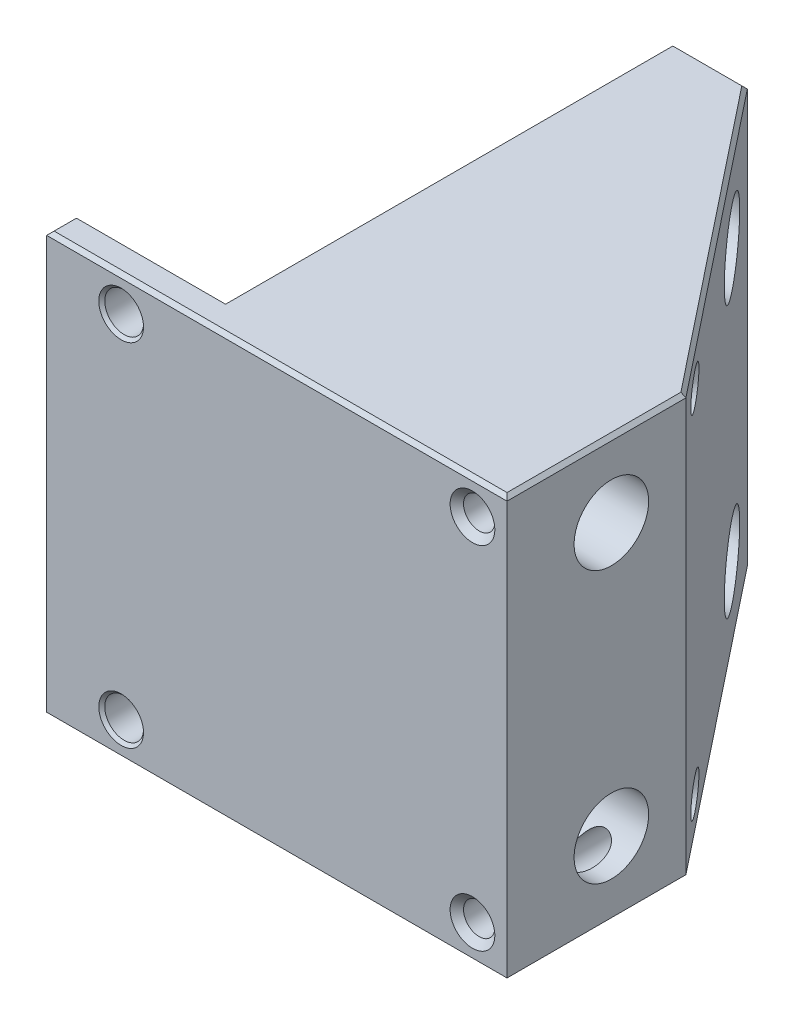
from build123d import *

# Parameters (mm, degrees)
SKETCH1_W                       = 61.76
SKETCH1_H                       = 56.4
BOSS_EXTRUDE1_DEPTH             = 4
M5X0_8_TAPPED_HOLE1_D           = 4.2
M5X0_8_TAPPED_HOLE1_CSINK_D     = 6
M5X0_8_TAPPED_HOLE1_CSINK_ANGLE = 90
BOSS_EXTRUDE7_START             = 60
SKETCH37_W                      = 41.76
SKETCH37_H                      = 56.4
SKETCH37_R                      = 2.1
BOSS_EXTRUDE7_DEPTH             = 60
SKETCH39_R                      = 2.6
CUT_EXTRUDE1_DEPTH              = 77.451385861
CUT_EXTRUDE2_DEPTH              = 88.946201737
CBORE_FOR_M5_SHCS3_D            = 5.5
CBORE_FOR_M5_SHCS3_CBORE_D      = 10
CBORE_FOR_M5_SHCS3_CBORE_DEPTH  = 36.7
CHAMFER7_SIZE                   = 0.5


with BuildPart() as part:
    # Sketch1 → Boss-Extrude1 (new body)
    with BuildSketch(Plane.XY):
        Rectangle(SKETCH1_W, SKETCH1_H)
    extrude(amount=BOSS_EXTRUDE1_DEPTH)

    # M5x0.8 Tapped Hole1 (through all)
    with Locations(Plane.XY.offset(4)):
        with Locations((26.245, 23.565), (26.245, -23.565), (-20.885, -23.565), (-20.885, 23.565)):
            CounterSinkHole(M5X0_8_TAPPED_HOLE1_D / 2, M5X0_8_TAPPED_HOLE1_CSINK_D / 2, counter_sink_angle=M5X0_8_TAPPED_HOLE1_CSINK_ANGLE)

    # Sketch37 → Boss-Extrude7 (add)
    with BuildSketch(Plane(origin=(0, 0, 0), x_dir=(-1, 0, 0), z_dir=(0, 0, -1)).offset(BOSS_EXTRUDE7_START)):
        with Locations((-10, 0)):
            Rectangle(SKETCH37_W, SKETCH37_H)
        with Locations((-26.245, 23.565)):
            Circle(SKETCH37_R, mode=Mode.SUBTRACT)
        with Locations((-26.245, -23.565)):
            Circle(SKETCH37_R, mode=Mode.SUBTRACT)
    extrude(amount=-BOSS_EXTRUDE7_DEPTH)

    # Sketch39 → Cut-Extrude1 (cut, through all)
    with BuildSketch(Plane.XY.offset(4)):
        with Locations((-20.885, -23.565)):
            Circle(SKETCH39_R)
        with Locations((-20.885, 23.565)):
            Circle(SKETCH39_R)
    extrude(amount=-CUT_EXTRUDE1_DEPTH, mode=Mode.SUBTRACT)

    # Sketch40 → Cut-Extrude2 (cut, through all)
    with BuildSketch(Plane.XZ.offset(28.2)):
        Polygon((-0.88, -60), (30.88, -20), (30.88, -60), align=None)
    extrude(amount=-CUT_EXTRUDE2_DEPTH, mode=Mode.SUBTRACT)

    # CBORE for M5 SHCS3 (through all)
    with Locations(Plane(origin=(30.88, 0, 0), x_dir=(0, 0, -1), z_dir=(1, 0, 0))):
        with Locations((10, -18.2), (10, 18.2), (50, 18.2), (50, -18.2)):
            CounterBoreHole(CBORE_FOR_M5_SHCS3_D / 2, CBORE_FOR_M5_SHCS3_CBORE_D / 2, CBORE_FOR_M5_SHCS3_CBORE_DEPTH)

    # Chamfer7
    chamfer7_edges = [part.edges().sort_by_distance(p)[0] for p in [
        (0, 28.2, 4),
        (-30.88, 28.2, 2),
        (-20.88, 28.2, 0),
        (-10.88, 28.2, -30),
        (-5.88, 28.2, -60),
        (15, 28.2, -40),
        (30.88, 28.2, -8),
        (-10.88, -28.2, -30),
        (-20.88, -28.2, 0),
        (-30.88, -28.2, 2),
        (0, -28.2, 4),
        (30.88, -28.2, -8),
        (15, -28.2, -40),
        (-5.88, -28.2, -60),
    ]]
    chamfer(chamfer7_edges, length=CHAMFER7_SIZE)


solid = part.part
